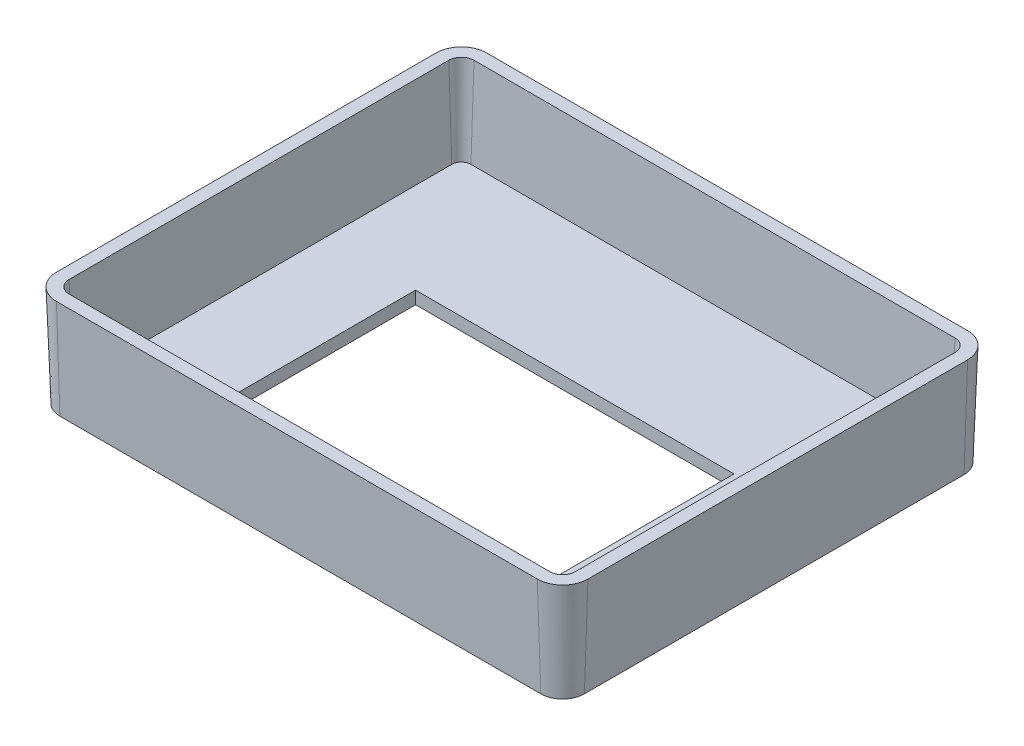
from build123d import *

# Parameters (mm, degrees)
BOSS_EXTRUDE1_DEPTH = 4
BOSS_EXTRUDE1_DRAFT = -2
SHELL1_T            = -0.5
SKETCH2_W           = 12.58
SKETCH2_H           = 6.98
CUT_EXTRUDE1_DEPTH  = 2


with BuildPart() as part:
    # Sketch1 → Boss-Extrude1 (with draft: the straight prism first)
    with BuildSketch(Plane(origin=(0, 0, 0), x_dir=(1, 0, 0), z_dir=(0, 1, 0))):
        with BuildLine():
            Line((-9.5, -8.5), (9.5, -8.5))
            ThreePointArc((9.5, -8.5), (10.207106781, -8.207106781), (10.5, -7.5))
            Line((10.5, -7.5), (10.5, 7.5))
            ThreePointArc((10.5, 7.5), (10.207106781, 8.207106781), (9.5, 8.5))
            Line((9.5, 8.5), (-9.5, 8.5))
            ThreePointArc((-9.5, 8.5), (-10.207106781, 8.207106781), (-10.5, 7.5))
            Line((-10.5, 7.5), (-10.5, -7.5))
            ThreePointArc((-10.5, -7.5), (-10.207106781, -8.207106781), (-9.5, -8.5))
        make_face()
    extrude(amount=-BOSS_EXTRUDE1_DEPTH)
    # Boss-Extrude1: the draft: its side faces are tilted about the plane it starts from
    boss_extrude1_sides = [part.faces().sort_by_distance(p)[0] for p in [
        (0, -2, 8.5),
        (10.207106781, -2, 8.207106781),
        (10.5, -2, 0),
        (10.207106781, -2, -8.207106781),
        (0, -2, -8.5),
        (-10.207106781, -2, -8.207106781),
        (-10.5, -2, 0),
        (-10.207106781, -2, 8.207106781),
    ]]
    draft(boss_extrude1_sides, Plane(origin=(0, 0, 0), x_dir=(1, 0, 0), z_dir=(0, 1, 0)), BOSS_EXTRUDE1_DRAFT)

    # Shell1
    shell1_openings = [part.faces().sort_by_distance(p)[0] for p in [
        (0, 0, 0),
    ]]
    offset(amount=SHELL1_T, openings=shell1_openings, kind=Kind.INTERSECTION)

    # Sketch2 → Cut-Extrude1 (cut)
    with BuildSketch(Plane.XZ.offset(4)):
        with Locations((0, 1.01)):
            Rectangle(SKETCH2_W, SKETCH2_H)
    extrude(amount=-CUT_EXTRUDE1_DEPTH, mode=Mode.SUBTRACT)


solid = part.part
